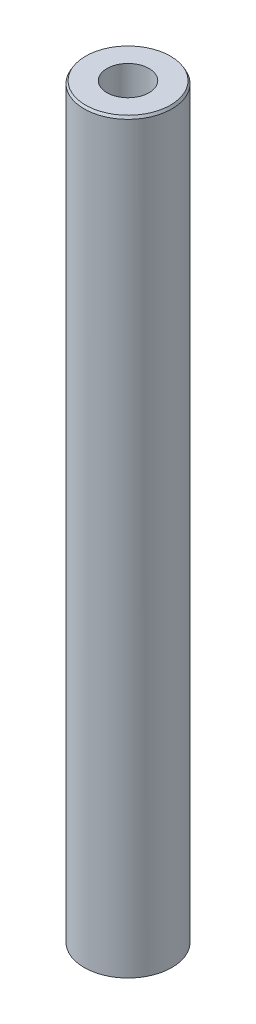
from build123d import *
from OCP.BRepFilletAPI import BRepFilletAPI_MakeChamfer

# Parameters (mm, degrees)
SKETCH1_R           = 12.5
BOSS_EXTRUDE1_DEPTH = 212.874090988
SKETCH2_R           = 5.989162941
CUT_EXTRUDE1_DEPTH  = 214.606831853
CHAMFER1_SIZE       = 0.719786517
CHAMFER1_SIZE2      = 0.415568939


with BuildPart() as part:
    # Sketch1 → Boss-Extrude1 (new body)
    with BuildSketch(Plane(origin=(0, 0, 0), x_dir=(1, 0, 0), z_dir=(0, 1, 0))):
        Circle(SKETCH1_R)
    extrude(amount=BOSS_EXTRUDE1_DEPTH)

    # Sketch2 → Cut-Extrude1 (cut, through all)
    with BuildSketch(Plane(origin=(0, 0, 0), x_dir=(1, 0, 0), z_dir=(0, 1, 0))):
        Circle(SKETCH2_R)
    extrude(amount=CUT_EXTRUDE1_DEPTH, mode=Mode.SUBTRACT)

    # Chamfer1: one chamfer whose edges measure the first distance from different faces: ONE call of the kernel's chamfer builder (chamfer() names one face for all edges)
    chamfer1_edges_1 = [part.edges().sort_by_distance(p)[0] for p in [
        (-12.5, 212.874090988, 0),
    ]]
    chamfer1_side_1 = [part.faces().sort_by_distance(p)[0] for p in [
        (-12.5, 106.437045494, 0),
    ]]
    chamfer1_edges_2 = [part.edges().sort_by_distance(p)[0] for p in [
        (-12.5, 0, 0),
    ]]
    chamfer1_side_2 = [part.faces().sort_by_distance(p)[0] for p in [
        (-12.146446609, 0, 0),
    ]]
    chamfer1 = BRepFilletAPI_MakeChamfer(part.part.solid().wrapped)
    for e in chamfer1_edges_1:
        chamfer1.Add(CHAMFER1_SIZE, CHAMFER1_SIZE2, e.wrapped, chamfer1_side_1[0].wrapped)  # the first distance lies on this face
    for e in chamfer1_edges_2:
        chamfer1.Add(CHAMFER1_SIZE, CHAMFER1_SIZE2, e.wrapped, chamfer1_side_2[0].wrapped)  # the first distance lies on this face
    add(Compound.cast(chamfer1.Shape()), mode=Mode.REPLACE)


solid = part.part
